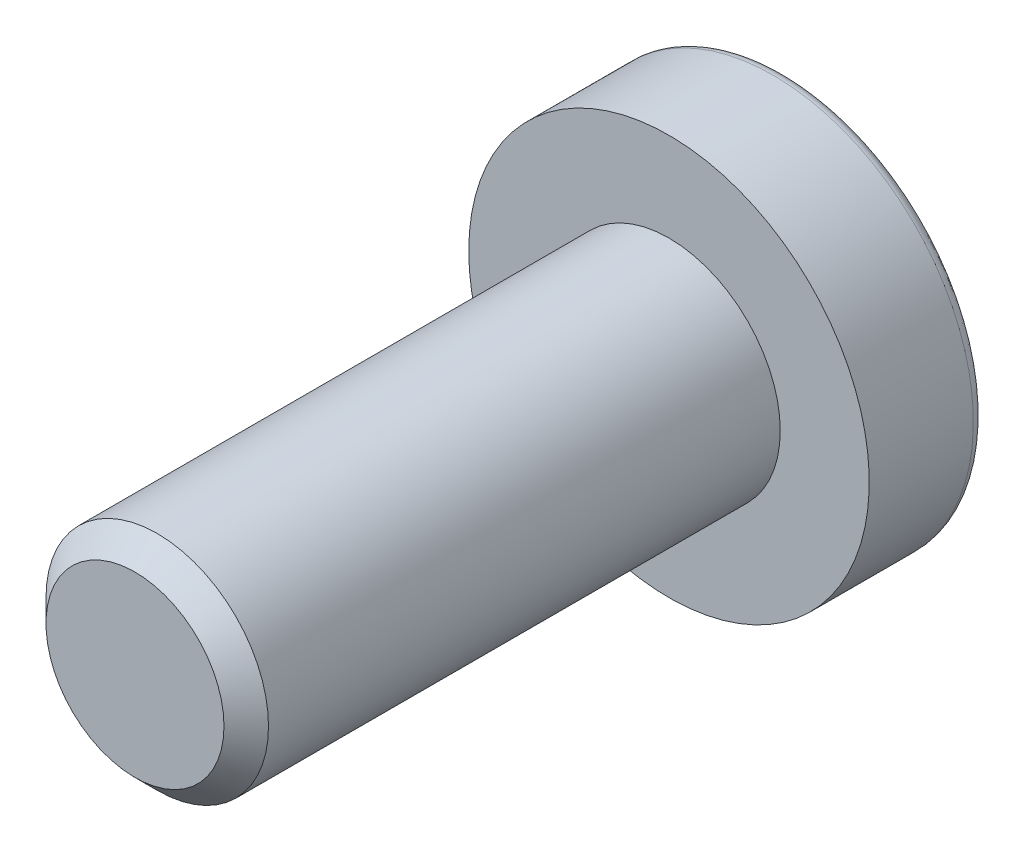
from build123d import *

# Parameters (mm, degrees)
ENLEV_MAT_EXTRU1_DEPTH = 1.1
ESQUISSE3_W            = 1.25
ESQUISSE3_H            = 6
CHANFREIN1_SIZE        = 0.25


with BuildPart() as part:
    # Esquisse1 → Base-Révolution (revolve)
    with BuildSketch(Plane(origin=(0, 0, 0), x_dir=(1, 0, 0), z_dir=(0, 1, 0)), mode=Mode.PRIVATE) as base_r_volution_sk:
        with BuildLine():
            Line((0, 0), (2.25, 0))
            Line((2.25, 0), (2.25, 1.17))
            ThreePointArc((2.25, 1.17), (2.211923882, 1.261923882), (2.12, 1.3))
            Line((2.12, 1.3), (0, 1.3))
            Line((0, 1.3), (0, 0))
        make_face()
    revolve(base_r_volution_sk.sketch.rotate(Axis((0, 0, 0), (0, 0, -1)), 180), axis=Axis((0, 0, 0), (0, 0, -1)))

    # Esquisse2 → enlev-mat-Extru1 (cut)
    with BuildSketch(Plane.XY.offset(-1.3)):
        Polygon((1, -0.577350269), (1, 0.577350269), (0, 1.154700538), (-1, 0.577350269), (-1, -0.577350269), (0, -1.154700538), align=None)
    extrude(amount=ENLEV_MAT_EXTRU1_DEPTH, mode=Mode.SUBTRACT)

    # Esquisse3 → Boss.-Révol.1 (revolve)
    with BuildSketch(Plane(origin=(0, 0, 0), x_dir=(1, 0, 0), z_dir=(0, 1, 0))):
        with Locations((0.625, -3)):
            Rectangle(ESQUISSE3_W, ESQUISSE3_H)
    revolve(axis=Axis((0, 0, 0), (0, 0, 1)))

    # Chanfrein1
    chanfrein1_edges = [part.edges().sort_by_distance(p)[0] for p in [
        (-1.25, 0, 6),
    ]]
    chamfer(chanfrein1_edges, length=CHANFREIN1_SIZE)


solid = part.part
